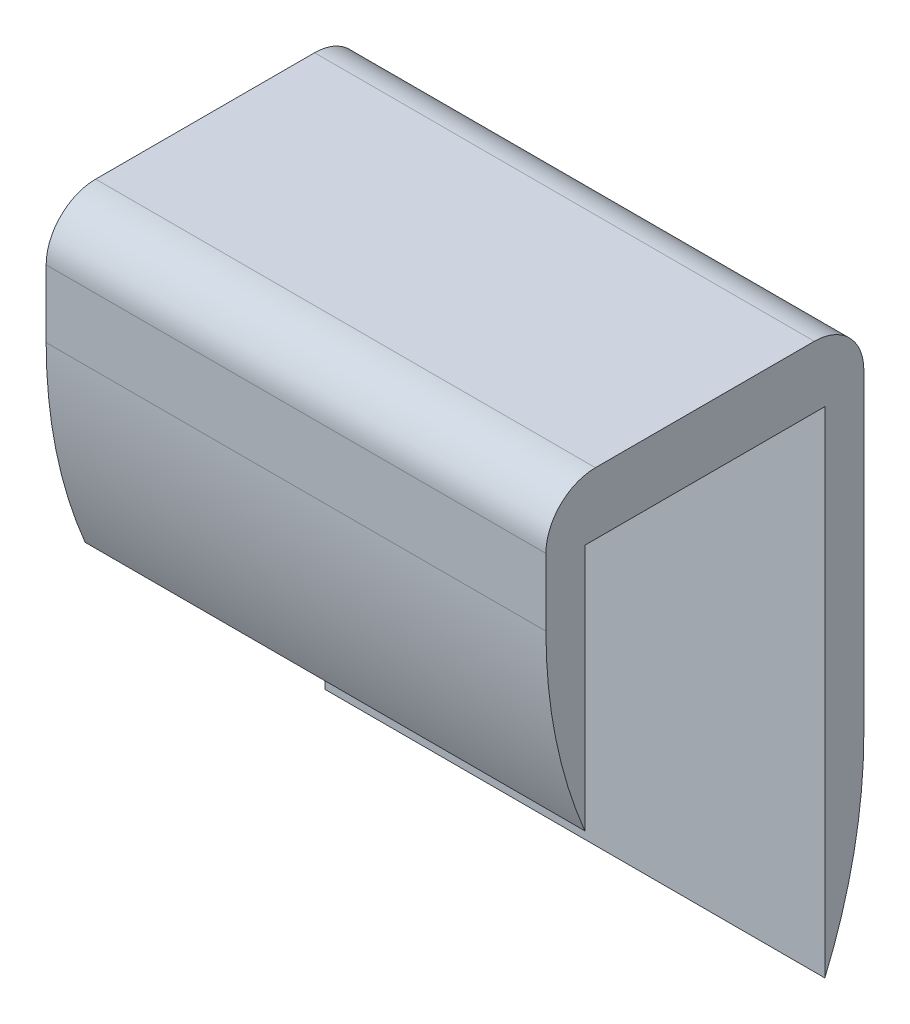
from build123d import *

# Parameters (mm, degrees)
BOSS_EXTRUDE1_DEPTH = 25.654
FILLET1_R           = 25.4
FILLET2_R           = 2.54


with BuildPart() as part:
    # Sketch1 → Boss-Extrude1 (new body)
    with BuildSketch(Plane(origin=(0, 0, 0), x_dir=(0, 0, -1), z_dir=(1, 0, 0))):
        Polygon((-8.1595, -12.7), (-6.1595, -12.7), (-6.1595, 0), (6.1595, 0), (6.1595, -25.4), (8.1595, -25.4), (8.1595, 3.175), (-8.1595, 3.175), align=None)
    extrude(amount=BOSS_EXTRUDE1_DEPTH)

    # Fillet1
    # the kernel refuses this fillet: 25.4 mm, written as the material it takes off along each edge
    with BuildSketch(Plane(origin=(-24.69817807, -12.7, 8.1595), x_dir=(0, 0, -1), z_dir=(1, 0, 0))) as fillet1_piece_1:
        with BuildLine():
            CenterArc((25.4, 9.879271228), FILLET1_R, 180, 22.889037196)
            Line((0, 9.879271228), (-0.508, 9.879271228))
            Line((-0.508, 9.879271228), (-0.508, 0))
            Line((-0.508, 0), (0, -0.508))
            ThreePointArc((0, -0.508), (1, -0.508), (1.532, -0.197585425))
            Line((1.532, -0.197585425), (2, 0))
        make_face()
    extrude(amount=75.050356141, mode=Mode.SUBTRACT)
    with BuildSketch(Plane(origin=(-24.69817807, -25.4, -8.1595), x_dir=(0, 0, 1), z_dir=(1, 0, 0))) as fillet1_piece_2:
        with BuildLine():
            CenterArc((25.4, -9.879271228), FILLET1_R, 157.110962804, 22.889037196)
            Line((0, -9.879271228), (-0.508, -9.879271228))
            Line((-0.508, -9.879271228), (-0.508, 0))
            Line((-0.508, 0), (0, 0.508))
            ThreePointArc((0, 0.508), (1, 0.508), (1.532, 0.197585425))
            Line((1.532, 0.197585425), (2, 0))
        make_face()
    extrude(amount=75.050356141, mode=Mode.SUBTRACT)

    # Fillet2
    fillet2_edges = [part.edges().sort_by_distance(p)[0] for p in [
        (12.827, 3.175, 8.1595),
        (12.827, 3.175, -8.1595),
    ]]
    fillet(fillet2_edges, radius=FILLET2_R)


solid = part.part
